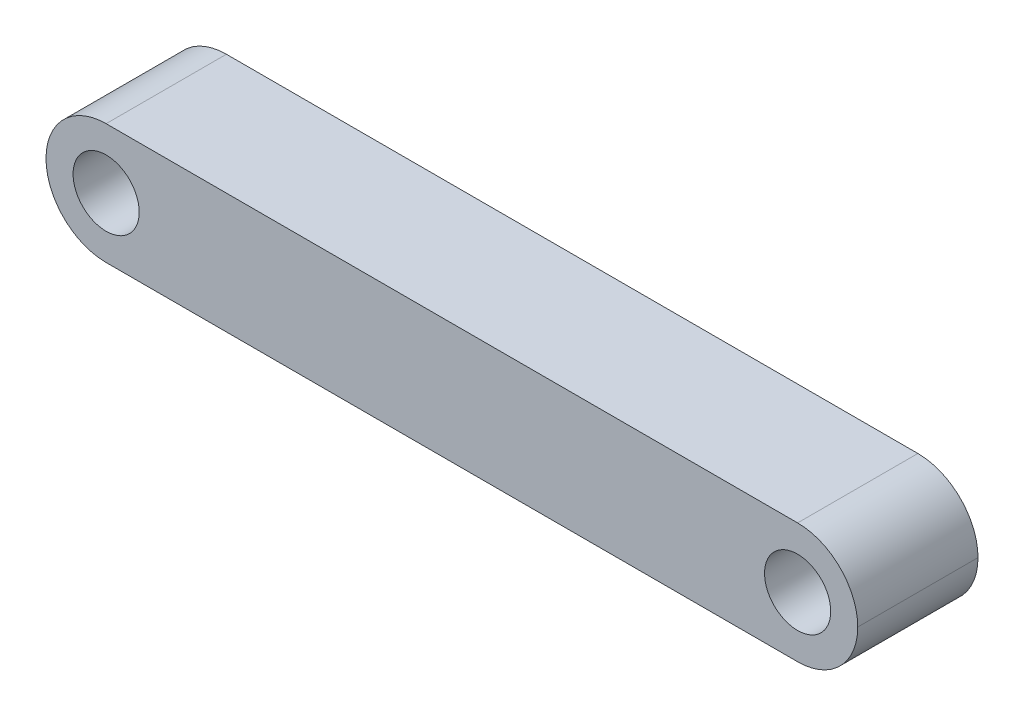
from build123d import *

# Parameters (mm, degrees)
SKETCH_1_W          = 27
SKETCH_1_H          = 4
EXTRUDE_1_DEPTH     = 4
FILLET_1_R          = 2
SKETCH_2_R          = 1.1
CUT_EXTRUDE_1_DEPTH = 13


with BuildPart() as part:
    # 草图1 → 凸台-拉伸1 (new body)
    with BuildSketch(Plane.XY):
        Rectangle(SKETCH_1_W, SKETCH_1_H)
    extrude(amount=EXTRUDE_1_DEPTH)

    # 圆角1
    fillet_1_edges = [part.edges().sort_by_distance(p)[0] for p in [
        (-13.5, -2, 2),
        (-13.5, 2, 2),
        (13.5, -2, 2),
        (13.5, 2, 2),
    ]]
    fillet(fillet_1_edges, radius=FILLET_1_R - 0.0001)  # a hair under: the kernel refuses the full size

    # 草图2 → 切除-拉伸1 (cut)
    with BuildSketch(Plane.XY.offset(4)):
        with Locations((-11.5, 0)):
            Circle(SKETCH_2_R)
        with Locations((11.5, 0)):
            Circle(SKETCH_2_R)
    extrude(amount=-CUT_EXTRUDE_1_DEPTH, mode=Mode.SUBTRACT)


solid = part.part
